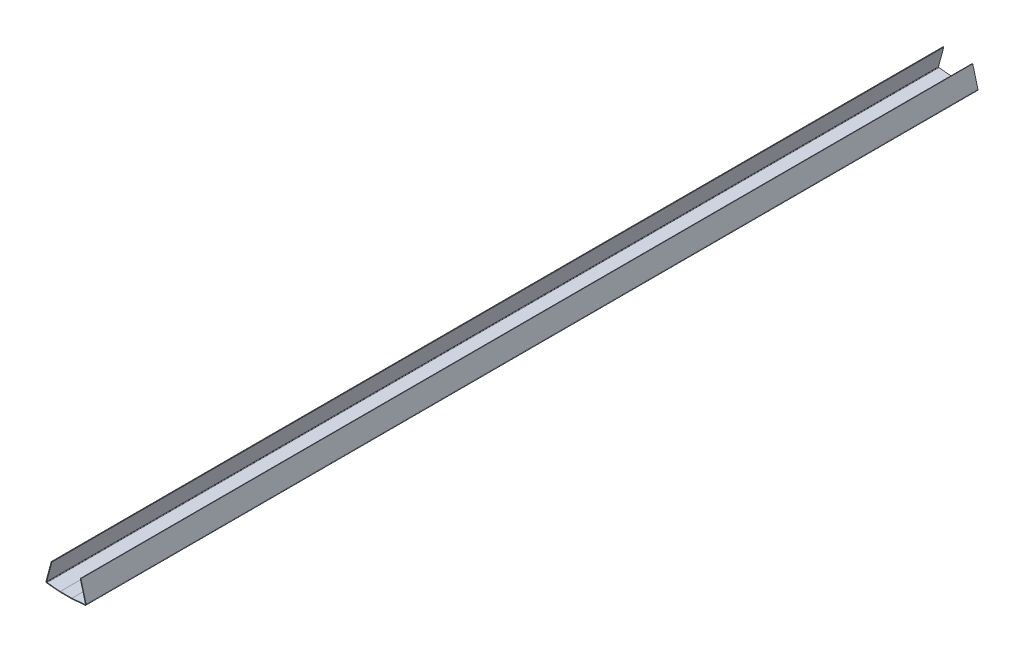
from build123d import *

# Parameters (mm, degrees)
BASE_FLANGE1_DEPTH = 1447.8


# Sheet-metal steps are written as plain solids
with BuildPart() as part:
    # Sketch1 → Base-Flange1 (new body)
    with BuildSketch(Plane.XY):
        with BuildLine():
            Line((-24.017856008, 35.793752438), (-32.508689678, 4.105529785))
            ThreePointArc((-32.508689678, 4.105529785), (-32.247725893, 2.625530619), (-30.946236469, 1.87411535))
            Line((-30.946236469, 1.87411535), (-9.602333754, 0.006765827))
            ThreePointArc((-9.602333754, 0.006765827), (-9.524926114, 0.001692262), (-9.447370844, 0))
            Line((-9.447370844, 0), (9.447370844, 0))
            ThreePointArc((9.447370844, 0), (9.524926114, 0.001692262), (9.602333754, 0.006765827))
            Line((9.602333754, 0.006765827), (30.946236469, 1.87411535))
            ThreePointArc((30.946236469, 1.87411535), (32.247725893, 2.625530619), (32.508689678, 4.105529785))
            Line((32.508689678, 4.105529785), (24.017856008, 35.793752438))
            Line((24.017856008, 35.793752438), (23.036475369, 35.530792289))
            Line((23.036475369, 35.530792289), (31.527309038, 3.842569635))
            ThreePointArc((31.527309038, 3.842569635), (31.415467416, 3.208284278), (30.857686234, 2.886249163))
            Line((30.857686234, 2.886249163), (9.513783519, 1.01889964))
            ThreePointArc((9.513783519, 1.01889964), (9.480608817, 1.016725255), (9.447370844, 1.016))
            Line((9.447370844, 1.016), (-9.447370844, 1.016))
            ThreePointArc((-9.447370844, 1.016), (-9.480608817, 1.016725255), (-9.513783519, 1.01889964))
            Line((-9.513783519, 1.01889964), (-30.857686234, 2.886249163))
            ThreePointArc((-30.857686234, 2.886249163), (-31.415467416, 3.208284278), (-31.527309038, 3.842569635))
            Line((-31.527309038, 3.842569635), (-23.036475369, 35.530792289))
            Line((-23.036475369, 35.530792289), (-24.017856008, 35.793752438))
        make_face()
    extrude(amount=-BASE_FLANGE1_DEPTH)


solid = part.part
